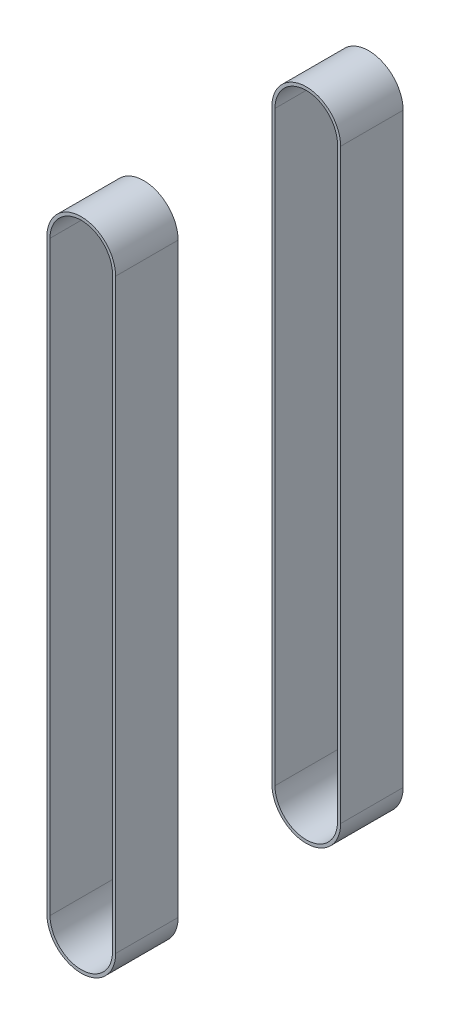
from build123d import *

# Parameters (mm, degrees)
BOSS_EXTRUDE1_START = 16.51
BOSS_EXTRUDE1_DEPTH = 12.7


with BuildPart() as part:
    # Sketch1 → Boss-Extrude1 (new body)
    with BuildSketch(Plane.XY.offset(BOSS_EXTRUDE1_START)):
        with BuildLine():
            Line((284.603747544, 88.432859497), (284.606648054, -30.768831472))
            ThreePointArc((284.606648054, -30.768831472), (291.591818016, -37.753661505), (298.57664805, -30.768491543))
            Line((298.57664805, -30.768491543), (298.57374754, 88.433199426))
            ThreePointArc((298.57374754, 88.433199426), (291.588577577, 95.418029459), (284.603747544, 88.432859497))
        make_face()
        with BuildLine():
            Line((285.238747544, 88.432874948), (285.241648054, -30.768816021))
            ThreePointArc((285.241648054, -30.768816021), (291.591802565, -37.118661505), (297.94164805, -30.768506994))
            Line((297.94164805, -30.768506994), (297.93874754, 88.433183975))
            ThreePointArc((297.93874754, 88.433183975), (291.588593028, 94.78302946), (285.238747544, 88.432874948))
        make_face(mode=Mode.SUBTRACT)
    extrude(amount=BOSS_EXTRUDE1_DEPTH)


with BuildPart() as body_2:
    # Mirror2: mirrored copy
    add(part.part.mirror(Plane.XY))


solid = Compound([part.part, body_2.part])
